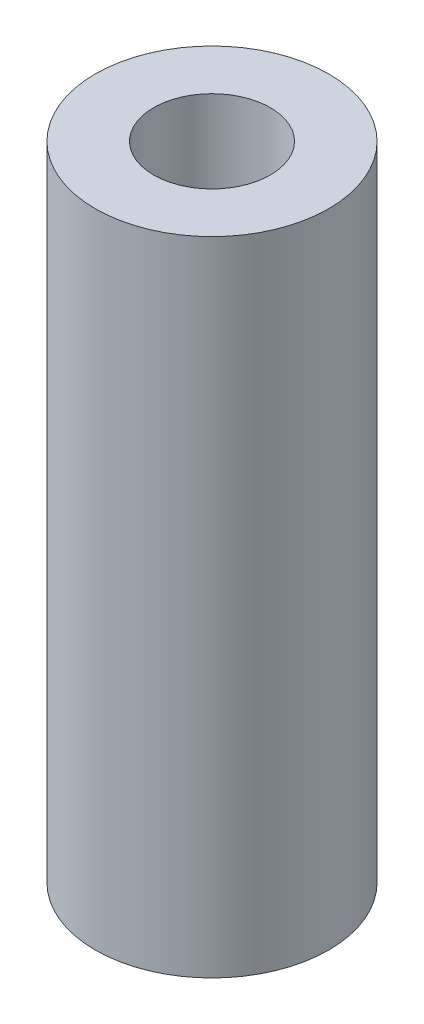
from build123d import *

# Parameters (mm, degrees)
SKETCH1_R           = 6.35
SKETCH1_R_2         = 3.175
BOSS_EXTRUDE1_DEPTH = 34.925


with BuildPart() as part:
    # Sketch1 → Boss-Extrude1 (new body)
    with BuildSketch(Plane(origin=(0, 0, 0), x_dir=(1, 0, 0), z_dir=(0, 1, 0))):
        Circle(SKETCH1_R)
        Circle(SKETCH1_R_2, mode=Mode.SUBTRACT)
    extrude(amount=BOSS_EXTRUDE1_DEPTH)


solid = part.part
